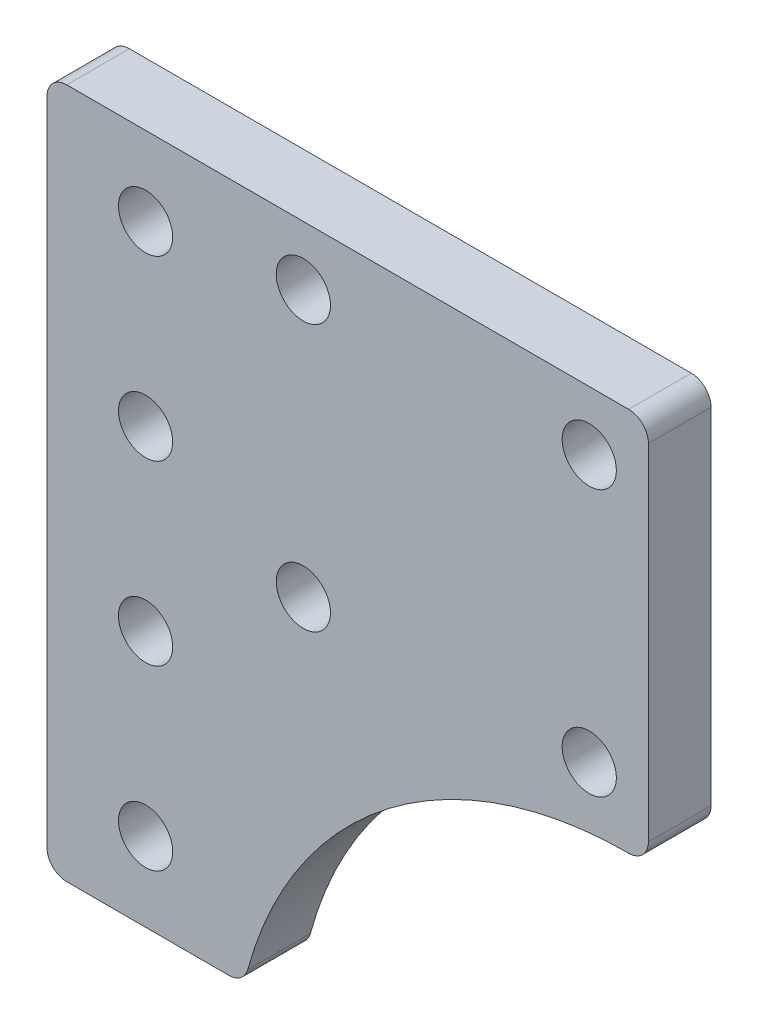
from build123d import *

# Parameters (mm, degrees)
BOSS_EXTRUDE1_DEPTH = 6.35
SKETCH4_R           = 2.75
CUT_EXTRUDE1_DEPTH  = 10
SKETCH5_R           = 2.75
CUT_EXTRUDE2_DEPTH  = 94.06622642
FILLET1_R           = 40
FILLET2_R           = 2


with BuildPart() as part:
    # Sketch2 → Boss-Extrude1 (new body)
    with BuildSketch(Plane.XY):
        Polygon((0, 0), (20, 0), (20, 31), (61, 31), (61, 70), (0, 70), align=None)
    extrude(amount=BOSS_EXTRUDE1_DEPTH)

    # Sketch4 → Cut-Extrude1 (cut)
    with BuildSketch(Plane(origin=(0, 0, 0), x_dir=(-1, 0, 0), z_dir=(0, 0, -1))):
        with Locations((-26, 64)):
            Circle(SKETCH4_R)
        with Locations((-54.999998701, 64)):
            Circle(SKETCH4_R)
        with Locations((-55, 37)):
            Circle(SKETCH4_R)
        with Locations((-26.000001299, 37)):
            Circle(SKETCH4_R)
    extrude(amount=-CUT_EXTRUDE1_DEPTH, mode=Mode.SUBTRACT)

    # Sketch5 → Cut-Extrude2 (cut, through all)
    with BuildSketch(Plane.XY.offset(6.35)):
        with Locations((10, 8)):
            Circle(SKETCH5_R)
        with Locations((10, 26)):
            Circle(SKETCH5_R)
        with Locations((10, 44)):
            Circle(SKETCH5_R)
        with Locations((10, 62)):
            Circle(SKETCH5_R)
    extrude(amount=-CUT_EXTRUDE2_DEPTH, mode=Mode.SUBTRACT)

    # Fillet1
    # the kernel refuses this fillet: 40 mm, written as the material it adds along each edge
    with BuildSketch(Plane(origin=(20, 31, 0), x_dir=(0, -1, 0), z_dir=(0, 0, 1))) as fillet1_piece_1:
        with BuildLine():
            CenterArc((40, 38.97435054), FILLET1_R, 180, 76.997121837)
            Line((0, 38.97435054), (-0.8, 38.97435054))
            Line((-0.8, 38.97435054), (-0.8, 0))
            Line((-0.8, 0), (0, -0.8))
            ThreePointArc((0, -0.8), (15.5, -0.8), (30.82, -0.779487011))
            Line((30.82, -0.779487011), (31, 0))
        make_face()
    extrude(amount=6.35)

    # Fillet2
    fillet2_edges = [part.edges().sort_by_distance(p)[0] for p in [
        (0, 70, 3.175),
        (61, 70, 3.175),
        (61, 31, 3.175),
        (20, 0, 3.175),
        (0, 0, 3.175),
    ]]
    fillet(fillet2_edges, radius=FILLET2_R)


solid = part.part
